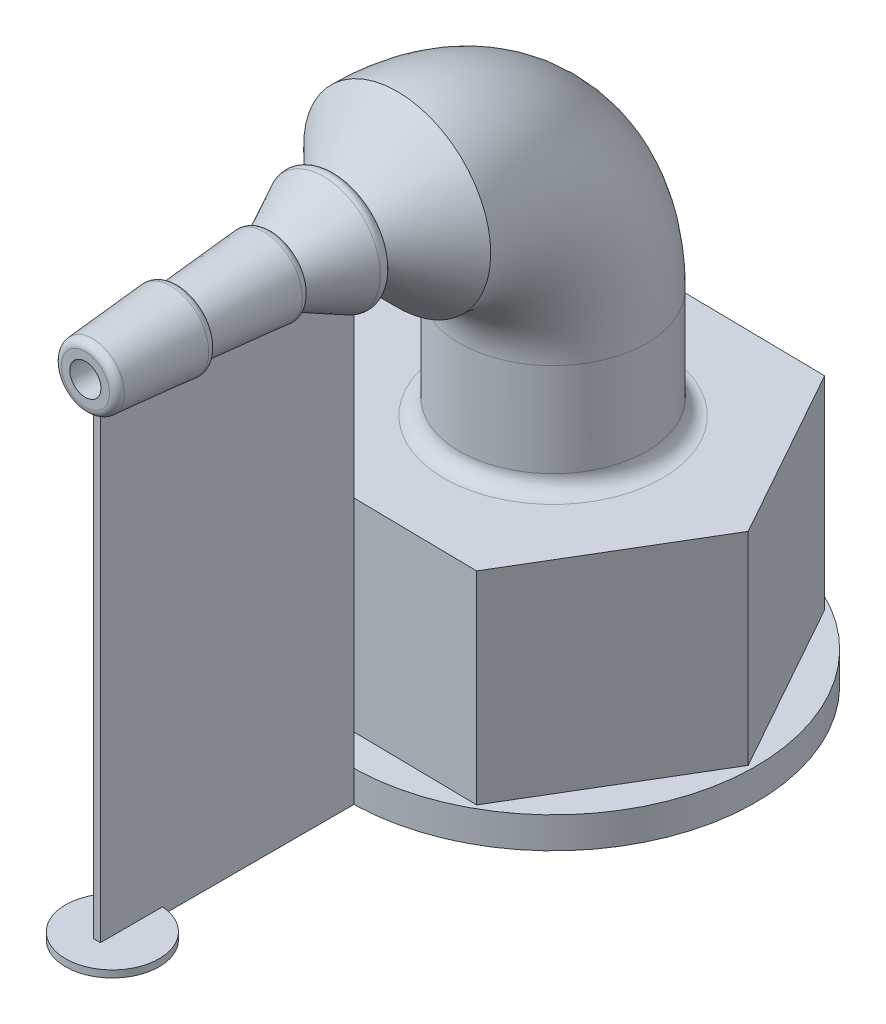
from build123d import *

# Parameters (mm, degrees)
SKETCH_1_R      = 4.75
EXTRUDE_1_DEPTH = 13
SKETCH_2_R      = 13
SKETCH_2_R_2    = 4.76999632
EXTRUDE_2_DEPTH = 2
SKETCH_4_R      = 6
SKETCH_4_R_2    = 1
FILLET_1_R      = 1
CHAMFER_1_SIZE  = 4
FILLET_2_R      = 0.5
SKETCH_6_W      = 16.260333428
SKETCH_6_H      = 29.938361119
EXTRUDE_4_DEPTH = 0.225
SKETCH_7_R      = 3
EXTRUDE_5_DEPTH = 0.45


with BuildPart() as part:
    # Эскиз1 → Бобышка-Вытянуть1 (new body)
    with BuildSketch(Plane(origin=(0, 0, 0), x_dir=(1, 0, 0), z_dir=(0, 1, 0))):
        Polygon((6.511020426, 10.905959213), (-6.189327518, 11.091688699), (-12.700347944, 0.185729487), (-6.511020426, -10.905959213), (6.189327518, -11.091688699), (12.700347944, -0.185729487), align=None)
        with Locations(Location((0, 0, 0), (0, 0, 90))):
            Circle(SKETCH_1_R, mode=Mode.SUBTRACT)
    extrude(amount=EXTRUDE_1_DEPTH)

    # Эскиз2 → Бобышка-Вытянуть2 (add)
    with BuildSketch(Plane.XZ):
        with Locations(Location((0, 0, 0), (0, 0, 270))):
            Circle(SKETCH_2_R)
        with Locations(Location((0, 0, 0), (0, 0, 270))):
            Circle(SKETCH_2_R_2, mode=Mode.SUBTRACT)
    extrude(amount=EXTRUDE_2_DEPTH)

    # По траектории1: sweep along a path in Эскиз3
    with BuildLine(Plane(origin=(0, 0, 0), x_dir=(0, 0, -1), z_dir=(1, 0, 0))) as sweep_1_path:
        Line((-30, 30), (-10, 30))
        ThreePointArc((-10, 30), (-2.928932188, 27.071067812), (0, 20))
        Line((0, 20), (0, 13))
    # Эскиз4 → По траектории1 (sweep)
    with BuildSketch(Plane(origin=(0, 13, 0), x_dir=(1, 0, 0), z_dir=(0, 1, 0))):
        Circle(SKETCH_4_R)
        Circle(SKETCH_4_R_2, mode=Mode.SUBTRACT)
    sweep(path=sweep_1_path.line)

    # Скругление1
    fillet_1_edges = [part.edges().sort_by_distance(p)[0] for p in [
        (-6, 13, 0),
    ]]
    fillet(fillet_1_edges, radius=FILLET_1_R)

    # Фаска1
    # the kernel refuses this chamfer: 4 mm, written as the material it takes off along each edge
    with BuildSketch(Plane(origin=(0, 13, 0), x_dir=(1, 0, 0), z_dir=(0, 0, -1))) as chamfer_1_piece_1_section:
        Polygon((1, -CHAMFER_1_SIZE), (1 + CHAMFER_1_SIZE, 0), (1, 0), align=None)
    chamfer_1_piece_1 = revolve(axis=Axis((0, 13, 0), (0, -1, 0)), mode=Mode.PRIVATE)
    chamfer_1_piece_1 = chamfer_1_piece_1 & Plane(origin=(0, 15.146163681, 0), x_dir=(0, 0, -1), z_dir=(0, -1, 0)) * Cylinder(4.75, 20, mode=Mode.PRIVATE)
    add(chamfer_1_piece_1, mode=Mode.SUBTRACT)

    # Эскиз5 → Вырез-Повернуть1 (revolve, cut)
    with BuildSketch(Plane(origin=(0, 0, 0), x_dir=(0, 0, -1), z_dir=(1, 0, 0)), mode=Mode.PRIVATE) as cut_revolve_1_sk:
        Polygon((-30, 32), (-24, 32.5), (-24, 32), (-18, 32.5), (-18, 32), (-14, 34), (-14, 32), (-10, 36), (-30, 36), align=None)
    revolve(cut_revolve_1_sk.sketch.rotate(Axis((0, 30, 30), (0, 0, -1)), 90), axis=Axis((0, 30, 30), (0, 0, -1)), mode=Mode.SUBTRACT)

    # Скругление2
    # the kernel refuses this fillet: 0.5 mm, written as the material it takes off along each edge
    with BuildSketch(Plane(origin=(0, 30, 14), x_dir=(1, 0, 0), z_dir=(0, 1, 0))) as fillet_2_piece_1:
        with BuildLine():
            CenterArc((4 - FILLET_2_R * 1.61803398875, -FILLET_2_R), FILLET_2_R, 333.434948823, 116.565051177)
            Line((4 - FILLET_2_R * 0.72360679775, -FILLET_2_R * 1.4472135955), (4, 0))
            Line((4, 0), (4 - FILLET_2_R * 1.61803398875, 0))
        make_face()
    revolve(axis=Axis((0, 30, 14), (0, 0, -1)), mode=Mode.SUBTRACT)
    with BuildSketch(Plane(origin=(0, 30, 18), x_dir=(1, 0, 0), z_dir=(0, 1, 0))) as fillet_2_piece_2:
        with BuildLine():
            CenterArc((1.956756353, -0.498126477), FILLET_2_R, 355.236358309, 89.802086132)
            Line((2.455029232, -0.539649217), (2.5, 0))
            Line((2.5, 0), (2, 0))
        make_face()
    revolve(axis=Axis((0, 30, 18), (0, 0, -1)), mode=Mode.SUBTRACT)
    with BuildSketch(Plane(origin=(0, 30, 24), x_dir=(1, 0, 0), z_dir=(0, 1, 0))) as fillet_2_piece_3:
        with BuildLine():
            CenterArc((1.956756353, -0.498126477), FILLET_2_R, 355.236358309, 89.802086132)
            Line((2.455029232, -0.539649217), (2.5, 0))
            Line((2.5, 0), (2, 0))
        make_face()
    revolve(axis=Axis((0, 30, 24), (0, 0, -1)), mode=Mode.SUBTRACT)
    with BuildSketch(Plane(origin=(0, 30, 30), x_dir=(1, 0, 0), z_dir=(0, 1, 0))) as fillet_2_piece_4:
        with BuildLine():
            CenterArc((2 - FILLET_2_R * 0.920132881566, FILLET_2_R), FILLET_2_R, 270, 85.236358309)
            Line((2 - FILLET_2_R * 0.920132881566, 0), (2, 0))
            Line((2, 0), (2 + FILLET_2_R * 0.0764128766789, FILLET_2_R * 0.916954520146))
        make_face()
    revolve(axis=Axis((0, 30, 30), (0, 0, -1)), mode=Mode.SUBTRACT)


with BuildPart() as body_2:
    # Эскиз6 → Бобышка-Вытянуть4 (new, symmetric)
    with BuildSketch(Plane(origin=(0, 0, 0), x_dir=(0, 0, -1), z_dir=(1, 0, 0))):
        with Locations((-21.130166714, 12.96918056)):
            Rectangle(SKETCH_6_W, SKETCH_6_H)
    extrude(amount=EXTRUDE_4_DEPTH, both=True)

    # Эскиз7 → Бобышка-Вытянуть5 (add)
    with BuildSketch(Plane.XZ.offset(2)):
        with Locations((0, 28.270577409)):
            Circle(SKETCH_7_R)
    extrude(amount=-EXTRUDE_5_DEPTH)


solid = Compound([part.part, body_2.part])
